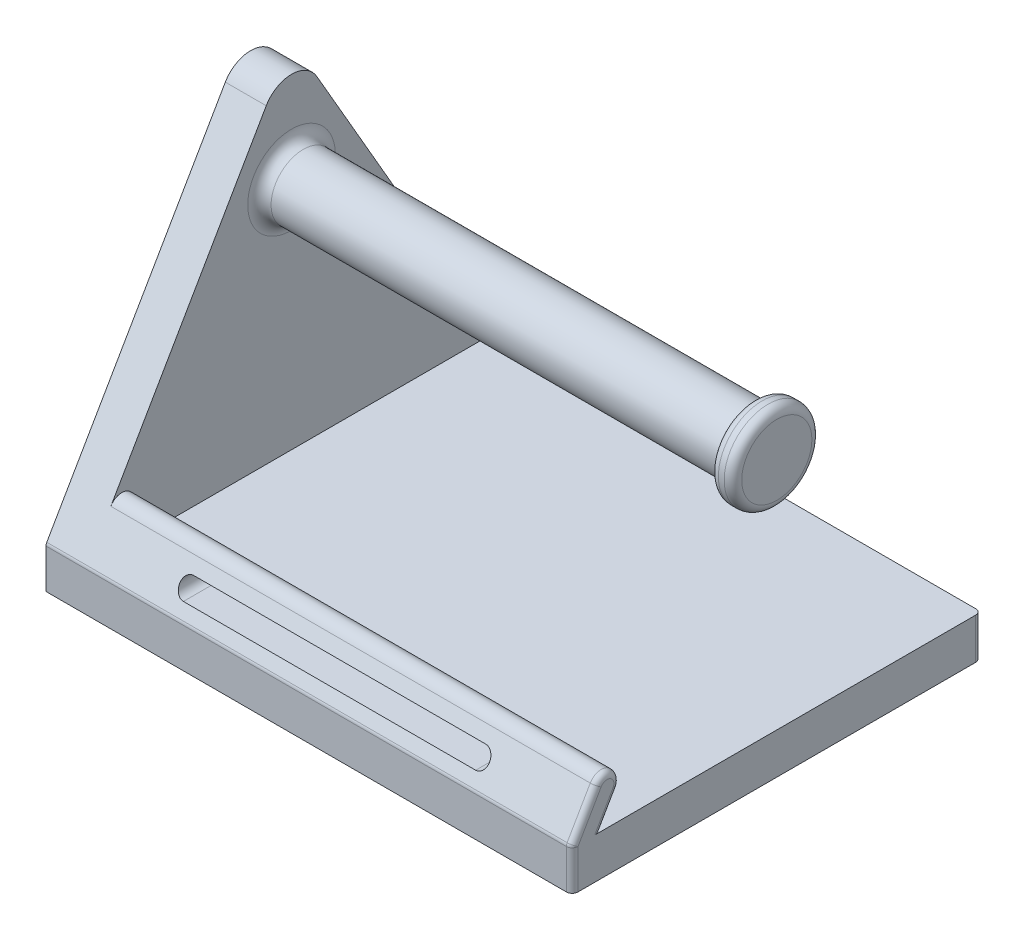
from build123d import *

# Parameters (mm, degrees)
SKETCH_2_W          = 90
SKETCH_2_H          = 70
EXTRUDE_1_DEPTH     = 7
EXTRUDE_4_DEPTH     = 7
SKETCH_9_R          = 5.5
EXTRUDE_5_DEPTH     = 79
EXTRUDE_START       = 79
SKETCH_10_R         = 7.5
EXTRUDE_6_DEPTH     = 4
EXTRUDE_7_DEPTH     = 83
CUT_EXTRUDE_1_DEPTH = 10
FILLET_START        = -1
FILLET_1_DEPTH      = 92
FILLET_2_R          = 1
FILLET_3_R          = 1.5
FILLET_4_R          = 1.5
FILLET_9_R          = 1
FILLET_10_R         = 1
FILLET_12_R         = 2


with BuildPart() as part:
    # 草图2 → 凸台-拉伸1 (new body)
    with BuildSketch(Plane(origin=(0, 0, 0), x_dir=(1, 0, 0), z_dir=(0, 1, 0))):
        with Locations((45, 35)):
            Rectangle(SKETCH_2_W, SKETCH_2_H)
    extrude(amount=-EXTRUDE_1_DEPTH)



with BuildPart() as body_2:
    # 草图4 → 凸台-拉伸4 (new body)
    with BuildSketch(Plane(origin=(0, 0, 0), x_dir=(0, 0, -1), z_dir=(1, 0, 0))):
        with BuildLine():
            Line((0, 0), (30.669872981, 53.121778265))
            ThreePointArc((30.669872981, 53.121778265), (35, 55.621778265), (39.330127019, 53.121778265))
            Line((39.330127019, 53.121778265), (70, 0))
            Line((70, 0), (0, 0))
        make_face()
    extrude(amount=EXTRUDE_4_DEPTH)

    # 草图9 → 凸台-拉伸5 (add)
    with BuildSketch(Plane(origin=(7, 0, 0), x_dir=(0, 0, -1), z_dir=(1, 0, 0))):
        with Locations((35, 40)):
            Circle(SKETCH_9_R)
    extrude(amount=EXTRUDE_5_DEPTH)

    # 草图10 → 凸台-拉伸6 (add)
    with BuildSketch(Plane(origin=(7, 0, 0), x_dir=(0, 0, -1), z_dir=(1, 0, 0)).offset(EXTRUDE_START)):
        with Locations((35, 40)):
            Circle(SKETCH_10_R)
    extrude(amount=EXTRUDE_6_DEPTH)


with BuildPart() as part_1:
    add(part.part)

    add(body_2.part)  # 凸台-拉伸7 merges body 2
    # 草图11 → 凸台-拉伸7 (add)
    with BuildSketch(Plane(origin=(7, 0, 0), x_dir=(0, 0, -1), z_dir=(1, 0, 0))):
        with BuildLine():
            Line((4.089101615, 7.082531755), (0, 0))
            Line((0, 0), (5, 0))
            Line((5, 0), (7.839101615, 4.917468245))
            ThreePointArc((7.839101615, 4.917468245), (7.04663337, 7.875), (4.089101615, 7.082531755))
        make_face()
    extrude(amount=EXTRUDE_7_DEPTH)

    # 草图13 → 切除-拉伸1 (cut)
    with BuildSketch(Plane.XY):
        with BuildLine():
            Line((22.297230248, 5.078430518), (72.297230248, 5.078430518))
            ThreePointArc((72.297230248, 5.078430518), (73.797230248, 3.578430518), (72.297230248, 2.078430518))
            Line((72.297230248, 2.078430518), (22.297230248, 2.078430518))
            ThreePointArc((22.297230248, 2.078430518), (20.797230248, 3.578430518), (22.297230248, 5.078430518))
        make_face()
    extrude(amount=-CUT_EXTRUDE_1_DEPTH, mode=Mode.SUBTRACT)

    # 圆角1: read off the stored shape, not the designer's step
    # 圆角1 outline → 圆角1 (cut)
    with BuildSketch(Plane.YZ.offset(FILLET_START)):
        with BuildLine():
            Line((0, -70), (0.232050808, -69.866025404))
            ThreePointArc((0.232050808, -69.866025404), (-0.009130147, -69.965925826), (-0.267949192, -70))
            Line((-0.267949192, -70), (0, -70))
        make_face()
    extrude(amount=FILLET_1_DEPTH, mode=Mode.SUBTRACT)

    # 圆角2
    fillet_2_edges = [part_1.edges().sort_by_distance(p)[0] for p in [
        (45, 0, 0),
    ]]
    fillet(fillet_2_edges, radius=FILLET_2_R)

    # 圆角3
    fillet_3_edges = [part_1.edges().sort_by_distance(p)[0] for p in [
        (90, 40, -27.5),
    ]]
    fillet(fillet_3_edges, radius=FILLET_3_R)

    # 圆角4
    fillet_4_edges = [part_1.edges().sort_by_distance(p)[0] for p in [
        (86, 40, -27.5),
    ]]
    fillet(fillet_4_edges, radius=FILLET_4_R)

    # 圆角9
    fillet_9_edges = [part_1.edges().sort_by_distance(p)[0] for p in [
        (90, 2.458734123, -6.419550808),
        (90, 3.657291281, -2.111538106),
        (90, 7.875, -7.04663337),
        (90, -3.633974596, 0),
        (90, -0.009130147, -0.034074174),
    ]]
    fillet(fillet_9_edges, radius=FILLET_9_R)

    # 圆角10
    # the kernel refuses this fillet: 1 mm, written as the material it takes off along each edge
    with BuildSketch(Plane(origin=(90, 2.232050808, -70), x_dir=(0, 0, 1), z_dir=(0, -1, 0))) as fillet_10_piece_1:
        with BuildLine():
            CenterArc((FILLET_10_R, FILLET_10_R), FILLET_10_R, 180, 90)
            Line((0, FILLET_10_R), (0, 0))
            Line((0, 0), (FILLET_10_R, 0))
        make_face()
    extrude(amount=11.732050808, mode=Mode.SUBTRACT)

    # 圆角12
    fillet_12_edges = [part_1.edges().sort_by_distance(p)[0] for p in [
        (7, 40, -29.5),
    ]]
    fillet(fillet_12_edges, radius=FILLET_12_R)


solid = part_1.part
